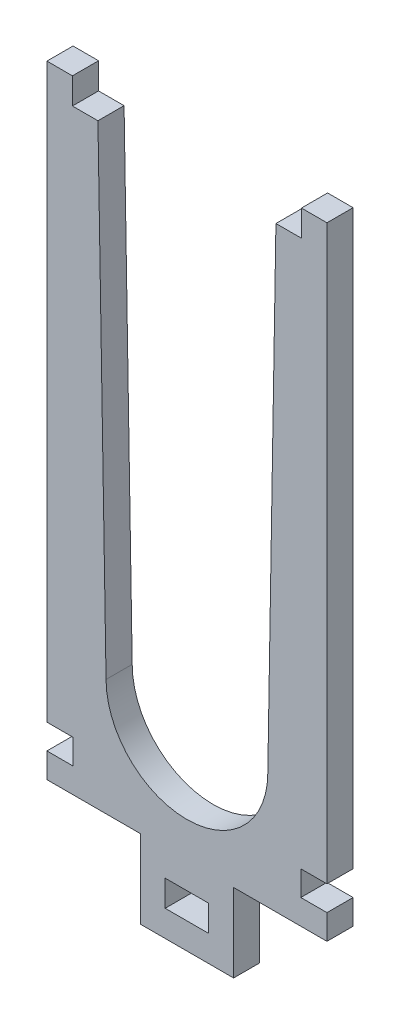
from build123d import *

# Parameters (mm, degrees)
SKETCH8_W           = 57.15
SKETCH8_H           = 127
BOSS_EXTRUDE3_DEPTH = 5.334
CUT_EXTRUDE4_DEPTH  = 140.368483008
SKETCH12_W          = 19.05
SKETCH12_H          = 5.334
CUT_EXTRUDE8_DEPTH  = 5.334
SKETCH14_W          = 10.414
SKETCH14_H          = 5.334
BOSS_EXTRUDE4_DEPTH = 5.334
SKETCH15_W          = 5.207
SKETCH15_H          = 5.334
CUT_EXTRUDE9_DEPTH  = 5.334
SKETCH22_W          = 19.05
SKETCH22_H          = 5.334
BOSS_EXTRUDE5_DEPTH = 10.668
SKETCH23_W          = 8.89
SKETCH23_H          = 5.334
CUT_EXTRUDE15_DEPTH = 145.245837417
SKETCH24_W          = 5.334
SKETCH24_H          = 5.08
CUT_EXTRUDE16_DEPTH = 145.245837417


with BuildPart() as part:
    # Sketch8 → Boss-Extrude3 (new body)
    with BuildSketch(Plane.XY):
        with Locations((28.575, 63.5)):
            Rectangle(SKETCH8_W, SKETCH8_H)
    extrude(amount=BOSS_EXTRUDE3_DEPTH)

    # Sketch9 → Cut-Extrude4 (cut, through all)
    with BuildSketch(Plane.XY.offset(5.334)):
        with BuildLine():
            Line((46.736, 127), (10.414, 127))
            Line((10.414, 127), (12.069819702, 29.083))
            ThreePointArc((12.069819702, 29.083), (28.575, 12.577819702), (45.080180298, 29.083))
            Line((45.080180298, 29.083), (46.736, 127))
        make_face()
    extrude(amount=-CUT_EXTRUDE4_DEPTH, mode=Mode.SUBTRACT)

    # Sketch12 → Cut-Extrude8 (cut)
    with BuildSketch(Plane(origin=(0, 0, 0), x_dir=(-1, 0, 0), z_dir=(0, -1, 0))):
        with Locations((-47.625, -2.667)):
            Rectangle(SKETCH12_W, SKETCH12_H)
        with Locations((-9.525, -2.667)):
            Rectangle(SKETCH12_W, SKETCH12_H)
    extrude(amount=-CUT_EXTRUDE8_DEPTH, mode=Mode.SUBTRACT)

    # Sketch14 → Boss-Extrude4 (add)
    with BuildSketch(Plane(origin=(0, 127, 0), x_dir=(1, 0, 0), z_dir=(0, 1, 0))):
        with Locations((51.943, -2.667)):
            Rectangle(SKETCH14_W, SKETCH14_H)
        with Locations((5.207, -2.667)):
            Rectangle(SKETCH14_W, SKETCH14_H)
    extrude(amount=BOSS_EXTRUDE4_DEPTH)

    # Sketch15 → Cut-Extrude9 (cut)
    with BuildSketch(Plane(origin=(0, 132.334, 0), x_dir=(1, 0, 0), z_dir=(0, 1, 0))):
        with Locations((7.8105, -2.667)):
            Rectangle(SKETCH15_W, SKETCH15_H)
        with Locations((49.3395, -2.667)):
            Rectangle(SKETCH15_W, SKETCH15_H)
    extrude(amount=-CUT_EXTRUDE9_DEPTH, mode=Mode.SUBTRACT)

    # Sketch22 → Boss-Extrude5 (add)
    with BuildSketch(Plane.XZ):
        with Locations((28.575, 2.667)):
            Rectangle(SKETCH22_W, SKETCH22_H)
    extrude(amount=BOSS_EXTRUDE5_DEPTH)

    # Sketch23 → Cut-Extrude15 (cut, through all)
    with BuildSketch(Plane(origin=(0, 0, 0), x_dir=(-1, 0, 0), z_dir=(0, 0, -1))):
        with Locations((-28.575, -2.667)):
            Rectangle(SKETCH23_W, SKETCH23_H)
    extrude(amount=-CUT_EXTRUDE15_DEPTH, mode=Mode.SUBTRACT)

    # Sketch24 → Cut-Extrude16 (cut, through all)
    with BuildSketch(Plane(origin=(0, 0, 0), x_dir=(-1, 0, 0), z_dir=(0, 0, -1))):
        with Locations((-54.483, 12.954)):
            Rectangle(SKETCH24_W, SKETCH24_H)
        with Locations((-2.667, 12.954)):
            Rectangle(SKETCH24_W, SKETCH24_H)
    extrude(amount=-CUT_EXTRUDE16_DEPTH, mode=Mode.SUBTRACT)


solid = part.part
